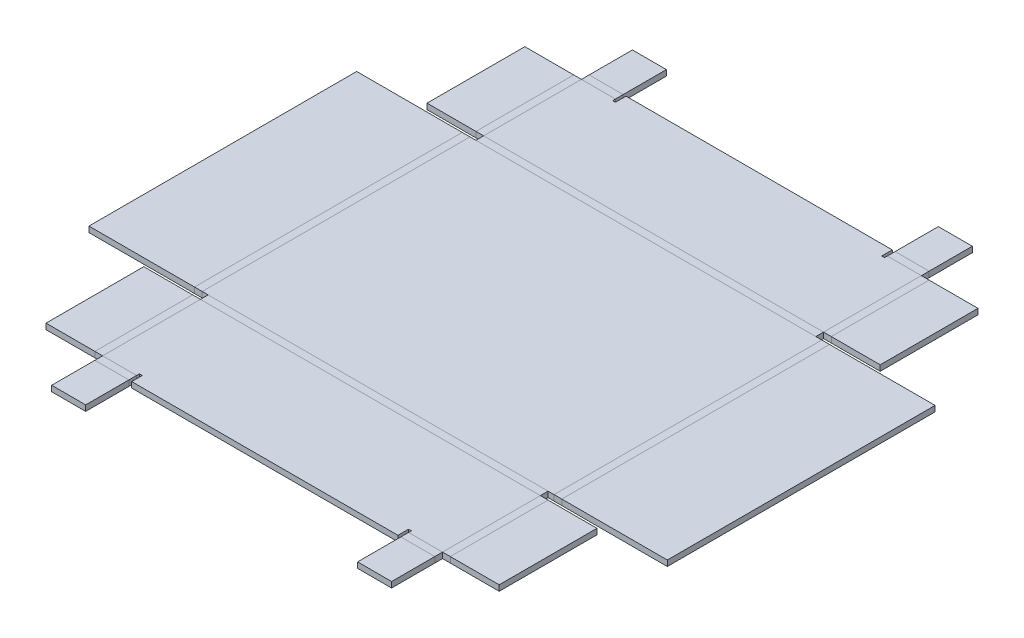
from build123d import *

# Parameters (mm, degrees)
SKETCH1_W                      = 120
SKETCH1_H                      = 100
BASE_FLANGE1_DEPTH             = 2
EDGE_FLANGE1_STRIP_W           = 9.4732
EDGE_FLANGE1_STRIP_H           = 2
EDGE_FLANGE1_STRIP_CUT_DEPTH   = 120
EDGE_FLANGE1_STRIP_2_W         = 9.4732
EDGE_FLANGE1_STRIP_2_H         = 2
EDGE_FLANGE1_STRIP_CUT_2_DEPTH = 120
EDGE_FLANGE1_DEPTH             = 120
EDGE_FLANGE1_BEND_DEPTH        = 120
EDGE_FLANGE2_DEPTH             = 94.5268
EDGE_FLANGE2_BEND_DEPTH        = 94.5268
EDGE_FLANGE5_STRIP_W           = 9.4732
EDGE_FLANGE5_STRIP_H           = 2
EDGE_FLANGE5_STRIP_CUT_DEPTH   = 12
EDGE_FLANGE5_RELIEF_W          = 10.4732
EDGE_FLANGE5_RELIEF_H          = 1
EDGE_FLANGE5_RELIEF_CUT_DEPTH  = 2
EDGE_FLANGE5_DEPTH             = 12
EDGE_FLANGE6_STRIP_W           = 9.4732
EDGE_FLANGE6_STRIP_H           = 2
EDGE_FLANGE6_STRIP_CUT_DEPTH   = 12
EDGE_FLANGE6_RELIEF_W          = 10.4732
EDGE_FLANGE6_RELIEF_H          = 1
EDGE_FLANGE6_RELIEF_CUT_DEPTH  = 2
EDGE_FLANGE6_DEPTH             = 12
EDGE_FLANGE7_STRIP_W           = 9.4732
EDGE_FLANGE7_STRIP_H           = 2
EDGE_FLANGE7_STRIP_CUT_DEPTH   = 12
EDGE_FLANGE7_RELIEF_W          = 10.4732
EDGE_FLANGE7_RELIEF_H          = 1
EDGE_FLANGE7_RELIEF_CUT_DEPTH  = 2
EDGE_FLANGE7_DEPTH             = 12
EDGE_FLANGE8_STRIP_W           = 9.4732
EDGE_FLANGE8_STRIP_H           = 2
EDGE_FLANGE8_STRIP_CUT_DEPTH   = 12
EDGE_FLANGE8_RELIEF_W          = 10.4732
EDGE_FLANGE8_RELIEF_H          = 1
EDGE_FLANGE8_RELIEF_CUT_DEPTH  = 2
EDGE_FLANGE8_DEPTH             = 12
EDGE_FLANGE9_DEPTH             = 34.5268
EDGE_FLANGE9_BEND_DEPTH        = 34.5268
EDGE_FLANGE9_BEND_2_DEPTH      = 34.5268
EDGE_FLANGE9_BEND_3_DEPTH      = 34.5268
UNFOLD1_START                  = 2
UNFOLD1_DEPTH                  = 38
UNFOLD1_2_DEPTH                = 2


# Read off the part's stored shape, not the designer's step: Unfold1
# Sheet-metal steps are written as plain solids
with BuildPart() as part:
    # Sketch1 → Base-Flange1 (new body)
    with BuildSketch(Plane(origin=(0, 0, 0), x_dir=(1, 0, 0), z_dir=(0, 1, 0))):
        Rectangle(SKETCH1_W, SKETCH1_H)
    extrude(amount=BASE_FLANGE1_DEPTH)

    # Edge-Flange1 strip (across the edge) → Edge-Flange1 strip cut (cut)
    with BuildSketch(Plane(origin=(60, 2, -50), x_dir=(0, 0, 1), z_dir=(-1, 0, 0))):
        with Locations((-2, -1)):
            Rectangle(EDGE_FLANGE1_STRIP_W, EDGE_FLANGE1_STRIP_H)
    extrude(amount=EDGE_FLANGE1_STRIP_CUT_DEPTH, mode=Mode.SUBTRACT)

    # Edge-Flange1 strip 2 (across the edge) → Edge-Flange1 strip cut 2 (cut)
    with BuildSketch(Plane(origin=(-60, 2, 50), x_dir=(0, 0, -1), z_dir=(1, 0, 0))):
        with Locations((-2, -1)):
            Rectangle(EDGE_FLANGE1_STRIP_2_W, EDGE_FLANGE1_STRIP_2_H)
    extrude(amount=EDGE_FLANGE1_STRIP_CUT_2_DEPTH, mode=Mode.SUBTRACT)

    # Edge-Flange1 section (across the edge) → Edge-Flange1 (add)
    with BuildSketch(Plane(origin=(60, 2, -50), x_dir=(0, 0, 1), z_dir=(-1, 0, 0))):
        with BuildLine():
            Line((0, 0.7366), (0, 38))
            Line((0, 38), (2, 38))
            Line((2, 38), (2, 0.7366))
            ThreePointArc((2, 0.7366), (2.215745145, 0.215745145), (2.7366, 0))
            Line((2.7366, 0), (2.7366, -2))
            ThreePointArc((2.7366, -2), (0.801531583, -1.198468417), (0, 0.7366))
        make_face()
    extrude(amount=EDGE_FLANGE1_DEPTH)

    # Edge-Flange1 section 2 (across the edge) → Edge-Flange1 bend (add)
    with BuildSketch(Plane(origin=(-60, 2, 50), x_dir=(0, 0, -1), z_dir=(1, 0, 0))):
        with BuildLine():
            Line((0, 0.7366), (0, 38))
            Line((0, 38), (2, 38))
            Line((2, 38), (2, 0.7366))
            ThreePointArc((2, 0.7366), (2.215745145, 0.215745145), (2.7366, 0))
            Line((2.7366, 0), (2.7366, -2))
            ThreePointArc((2.7366, -2), (0.801531583, -1.198468417), (0, 0.7366))
        make_face()
    extrude(amount=EDGE_FLANGE1_BEND_DEPTH)

    # Edge-Flange2 section (across the edge) → Edge-Flange2 (add)
    with BuildSketch(Plane(origin=(-62.8366, 2, -47.2634), x_dir=(1, 0, 0), z_dir=(0, 0, 1))):
        with BuildLine():
            Line((-2, 0.7366), (-2, 38))
            Line((-2, 38), (0, 38))
            Line((0, 38), (0, 0.7366))
            ThreePointArc((0, 0.7366), (0.215745145, 0.215745145), (0.7366, 0))
            Line((0.7366, 0), (2.8366, 0))
            Line((2.8366, 0), (2.8366, -2))
            Line((2.8366, -2), (0.7366, -2))
            ThreePointArc((0.7366, -2), (-1.198468417, -1.198468417), (-2, 0.7366))
        make_face()
    extrude(amount=EDGE_FLANGE2_DEPTH)

    # Edge-Flange2 section 2 (across the edge) → Edge-Flange2 bend (add)
    with BuildSketch(Plane(origin=(62.8366, 2, 47.2634), x_dir=(-1, 0, 0), z_dir=(0, 0, -1))):
        with BuildLine():
            Line((-2, 0.7366), (-2, 38))
            Line((-2, 38), (0, 38))
            Line((0, 38), (0, 0.7366))
            ThreePointArc((0, 0.7366), (0.215745145, 0.215745145), (0.7366, 0))
            Line((0.7366, 0), (2.8366, 0))
            Line((2.8366, 0), (2.8366, -2))
            Line((2.8366, -2), (0.7366, -2))
            ThreePointArc((0.7366, -2), (-1.198468417, -1.198468417), (-2, 0.7366))
        make_face()
    extrude(amount=EDGE_FLANGE2_BEND_DEPTH)

    # Edge-Flange5 strip (across the edge) → Edge-Flange5 strip cut (cut)
    with BuildSketch(Plane(origin=(48, 40, 48), x_dir=(0, -1, 0), z_dir=(1, 0, 0))):
        with Locations((-2, -1)):
            Rectangle(EDGE_FLANGE5_STRIP_W, EDGE_FLANGE5_STRIP_H)
    extrude(amount=EDGE_FLANGE5_STRIP_CUT_DEPTH, mode=Mode.SUBTRACT)

    # Edge-Flange5 relief (on the sheet) → Edge-Flange5 relief cut (cut)
    with BuildSketch(Plane(origin=(48, 37.2634, 48), x_dir=(0, -1, 0), z_dir=(0, 0, -1))):
        with Locations((-4.2366, 0.5)):
            Rectangle(EDGE_FLANGE5_RELIEF_W, EDGE_FLANGE5_RELIEF_H)
    extrude(amount=-EDGE_FLANGE5_RELIEF_CUT_DEPTH, mode=Mode.SUBTRACT)

    # Edge-Flange5 section (across the edge) → Edge-Flange5 (add)
    with BuildSketch(Plane(origin=(48, 40, 48), x_dir=(0, -1, 0), z_dir=(1, 0, 0))):
        with BuildLine():
            Line((0, 0.7366), (0, 16))
            Line((0, 16), (2, 16))
            Line((2, 16), (2, 0.7366))
            ThreePointArc((2, 0.7366), (2.215745145, 0.215745145), (2.7366, 0))
            Line((2.7366, 0), (2.7366, -2))
            ThreePointArc((2.7366, -2), (0.801531583, -1.198468417), (0, 0.7366))
        make_face()
    extrude(amount=EDGE_FLANGE5_DEPTH)

    # Edge-Flange6 strip (across the edge) → Edge-Flange6 strip cut (cut)
    with BuildSketch(Plane(origin=(-60, 40, 48), x_dir=(0, -1, 0), z_dir=(1, 0, 0))):
        with Locations((-2, -1)):
            Rectangle(EDGE_FLANGE6_STRIP_W, EDGE_FLANGE6_STRIP_H)
    extrude(amount=EDGE_FLANGE6_STRIP_CUT_DEPTH, mode=Mode.SUBTRACT)

    # Edge-Flange6 relief (on the sheet) → Edge-Flange6 relief cut (cut)
    with BuildSketch(Plane(origin=(-60, 37.2634, 48), x_dir=(0, -1, 0), z_dir=(0, 0, -1))):
        with Locations((-4.2366, -12.5)):
            Rectangle(EDGE_FLANGE6_RELIEF_W, EDGE_FLANGE6_RELIEF_H)
    extrude(amount=-EDGE_FLANGE6_RELIEF_CUT_DEPTH, mode=Mode.SUBTRACT)

    # Edge-Flange6 section (across the edge) → Edge-Flange6 (add)
    with BuildSketch(Plane(origin=(-60, 40, 48), x_dir=(0, -1, 0), z_dir=(1, 0, 0))):
        with BuildLine():
            Line((0, 0.7366), (0, 16))
            Line((0, 16), (2, 16))
            Line((2, 16), (2, 0.7366))
            ThreePointArc((2, 0.7366), (2.215745145, 0.215745145), (2.7366, 0))
            Line((2.7366, 0), (2.7366, -2))
            ThreePointArc((2.7366, -2), (0.801531583, -1.198468417), (0, 0.7366))
        make_face()
    extrude(amount=EDGE_FLANGE6_DEPTH)

    # Edge-Flange7 strip (across the edge) → Edge-Flange7 strip cut (cut)
    with BuildSketch(Plane(origin=(-48, 40, -48), x_dir=(0, -1, 0), z_dir=(-1, 0, 0))):
        with Locations((-2, -1)):
            Rectangle(EDGE_FLANGE7_STRIP_W, EDGE_FLANGE7_STRIP_H)
    extrude(amount=EDGE_FLANGE7_STRIP_CUT_DEPTH, mode=Mode.SUBTRACT)

    # Edge-Flange7 relief (on the sheet) → Edge-Flange7 relief cut (cut)
    with BuildSketch(Plane(origin=(-48, 37.2634, -48), x_dir=(0, -1, 0), z_dir=(0, 0, 1))):
        with Locations((-4.2366, 0.5)):
            Rectangle(EDGE_FLANGE7_RELIEF_W, EDGE_FLANGE7_RELIEF_H)
    extrude(amount=-EDGE_FLANGE7_RELIEF_CUT_DEPTH, mode=Mode.SUBTRACT)

    # Edge-Flange7 section (across the edge) → Edge-Flange7 (add)
    with BuildSketch(Plane(origin=(-48, 40, -48), x_dir=(0, -1, 0), z_dir=(-1, 0, 0))):
        with BuildLine():
            Line((0, 0.7366), (0, 16))
            Line((0, 16), (2, 16))
            Line((2, 16), (2, 0.7366))
            ThreePointArc((2, 0.7366), (2.215745145, 0.215745145), (2.7366, 0))
            Line((2.7366, 0), (2.7366, -2))
            ThreePointArc((2.7366, -2), (0.801531583, -1.198468417), (0, 0.7366))
        make_face()
    extrude(amount=EDGE_FLANGE7_DEPTH)

    # Edge-Flange8 strip (across the edge) → Edge-Flange8 strip cut (cut)
    with BuildSketch(Plane(origin=(60, 40, -48), x_dir=(0, -1, 0), z_dir=(-1, 0, 0))):
        with Locations((-2, -1)):
            Rectangle(EDGE_FLANGE8_STRIP_W, EDGE_FLANGE8_STRIP_H)
    extrude(amount=EDGE_FLANGE8_STRIP_CUT_DEPTH, mode=Mode.SUBTRACT)

    # Edge-Flange8 relief (on the sheet) → Edge-Flange8 relief cut (cut)
    with BuildSketch(Plane(origin=(60, 37.2634, -48), x_dir=(0, -1, 0), z_dir=(0, 0, 1))):
        with Locations((-4.2366, -12.5)):
            Rectangle(EDGE_FLANGE8_RELIEF_W, EDGE_FLANGE8_RELIEF_H)
    extrude(amount=-EDGE_FLANGE8_RELIEF_CUT_DEPTH, mode=Mode.SUBTRACT)

    # Edge-Flange8 section (across the edge) → Edge-Flange8 (add)
    with BuildSketch(Plane(origin=(60, 40, -48), x_dir=(0, -1, 0), z_dir=(-1, 0, 0))):
        with BuildLine():
            Line((0, 0.7366), (0, 16))
            Line((0, 16), (2, 16))
            Line((2, 16), (2, 0.7366))
            ThreePointArc((2, 0.7366), (2.215745145, 0.215745145), (2.7366, 0))
            Line((2.7366, 0), (2.7366, -2))
            ThreePointArc((2.7366, -2), (0.801531583, -1.198468417), (0, 0.7366))
        make_face()
    extrude(amount=EDGE_FLANGE8_DEPTH)

    # Edge-Flange9 section (across the edge) → Edge-Flange9 (add)
    with BuildSketch(Plane(origin=(60.7366, 37.2634, 48), x_dir=(-1, 0, 0), z_dir=(0, -1, 0))):
        with BuildLine():
            Line((-2, 0.7366), (-2, 18))
            Line((-2, 18), (0, 18))
            Line((0, 18), (0, 0.7366))
            ThreePointArc((0, 0.7366), (0.215745145, 0.215745145), (0.7366, 0))
            Line((0.7366, 0), (0.7366, -2))
            ThreePointArc((0.7366, -2), (-1.198468417, -1.198468417), (-2, 0.7366))
        make_face()
    extrude(amount=EDGE_FLANGE9_DEPTH)

    # Edge-Flange9 section 2 (across the edge) → Edge-Flange9 bend (add)
    with BuildSketch(Plane(origin=(60.7366, 2.7366, -48), x_dir=(-1, 0, 0), z_dir=(0, 1, 0))):
        with BuildLine():
            Line((-2, 0.7366), (-2, 18))
            Line((-2, 18), (0, 18))
            Line((0, 18), (0, 0.7366))
            ThreePointArc((0, 0.7366), (0.215745145, 0.215745145), (0.7366, 0))
            Line((0.7366, 0), (0.7366, -2))
            ThreePointArc((0.7366, -2), (-1.198468417, -1.198468417), (-2, 0.7366))
        make_face()
    extrude(amount=EDGE_FLANGE9_BEND_DEPTH)

    # Edge-Flange9 section 3 (across the edge) → Edge-Flange9 bend 2 (add)
    with BuildSketch(Plane(origin=(-60.7366, 37.2634, -48), x_dir=(1, 0, 0), z_dir=(0, -1, 0))):
        with BuildLine():
            Line((-2, 0.7366), (-2, 18))
            Line((-2, 18), (0, 18))
            Line((0, 18), (0, 0.7366))
            ThreePointArc((0, 0.7366), (0.215745145, 0.215745145), (0.7366, 0))
            Line((0.7366, 0), (0.7366, -2))
            ThreePointArc((0.7366, -2), (-1.198468417, -1.198468417), (-2, 0.7366))
        make_face()
    extrude(amount=EDGE_FLANGE9_BEND_2_DEPTH)

    # Edge-Flange9 section 4 (across the edge) → Edge-Flange9 bend 3 (add)
    with BuildSketch(Plane(origin=(-60.7366, 2.7366, 48), x_dir=(1, 0, 0), z_dir=(0, 1, 0))):
        with BuildLine():
            Line((-2, 0.7366), (-2, 18))
            Line((-2, 18), (0, 18))
            Line((0, 18), (0, 0.7366))
            ThreePointArc((0, 0.7366), (0.215745145, 0.215745145), (0.7366, 0))
            Line((0.7366, 0), (0.7366, -2))
            ThreePointArc((0.7366, -2), (-1.198468417, -1.198468417), (-2, 0.7366))
        make_face()
    extrude(amount=EDGE_FLANGE9_BEND_3_DEPTH)

    # Unfold1 outline → Unfold1 (cut)
    with BuildSketch(Plane(origin=(0, 0, 0), x_dir=(1, 0, 0), z_dir=(0, 1, 0)).offset(UNFOLD1_START)):
        with BuildLine():
            Line((62.7366, -47.2634), (64.8366, -47.2634))
            Line((64.8366, -47.2634), (64.8366, 47.2634))
            Line((64.8366, 47.2634), (62.7366, 47.2634))
            ThreePointArc((62.7366, 47.2634), (61.935068417, 49.198468417), (60, 50))
            Line((60, 50), (-60, 50))
            ThreePointArc((-60, 50), (-61.935068417, 49.198468417), (-62.7366, 47.2634))
            Line((-62.7366, 47.2634), (-64.8366, 47.2634))
            Line((-64.8366, 47.2634), (-64.8366, -47.2634))
            Line((-64.8366, -47.2634), (-62.7366, -47.2634))
            ThreePointArc((-62.7366, -47.2634), (-61.935068417, -49.198468417), (-60, -50))
            Line((-60, -50), (60, -50))
            ThreePointArc((60, -50), (61.935068417, -49.198468417), (62.7366, -47.2634))
        make_face()
        with BuildLine():
            ThreePointArc((60.7366, -47.2634), (60.520854855, -47.784254855), (60, -48))
            Line((60, -48), (60, -47.2634))
            Line((60, -47.2634), (60.7366, -47.2634))
        make_face(mode=Mode.SUBTRACT)
        with BuildLine():
            Line((-60.7366, -47.2634), (-60, -47.2634))
            Line((-60, -47.2634), (-60, -48))
            ThreePointArc((-60, -48), (-60.520854855, -47.784254855), (-60.7366, -47.2634))
        make_face(mode=Mode.SUBTRACT)
        with BuildLine():
            Line((-60, 47.2634), (-60.7366, 47.2634))
            ThreePointArc((-60.7366, 47.2634), (-60.520854855, 47.784254855), (-60, 48))
            Line((-60, 48), (-60, 47.2634))
        make_face(mode=Mode.SUBTRACT)
        with BuildLine():
            Line((60.7366, 47.2634), (60, 47.2634))
            Line((60, 47.2634), (60, 48))
            ThreePointArc((60, 48), (60.520854855, 47.784254855), (60.7366, 47.2634))
        make_face(mode=Mode.SUBTRACT)
    extrude(amount=UNFOLD1_DEPTH, mode=Mode.SUBTRACT)

    # Unfold1 2 outline → Unfold1 2 (add)
    with BuildSketch(Plane(origin=(0, 0, 0), x_dir=(1, 0, 0), z_dir=(0, 1, 0))):
        Polygon((102.091244901, -47.2634), (102.091244901, 47.2634), (60, 47.2634), (60, 49.991244901), (79.991244901, 49.991244901), (79.991244901, 84.518044901), (60, 84.518044901), (60, 102.509289802), (48, 102.509289802), (48, 83.518044901), (47, 83.518044901), (47, 87.254644901), (-47, 87.254644901), (-47, 83.518044901), (-48, 83.518044901), (-48, 102.509289802), (-60, 102.509289802), (-60, 84.518044901), (-79.991244901, 84.518044901), (-79.991244901, 49.991244901), (-60, 49.991244901), (-60, 47.2634), (-102.091244901, 47.2634), (-102.091244901, -47.2634), (-60, -47.2634), (-60, -49.991244901), (-79.991244901, -49.991244901), (-79.991244901, -84.518044901), (-60, -84.518044901), (-60, -102.509289802), (-48, -102.509289802), (-48, -83.518044901), (-47, -83.518044901), (-47, -87.254644901), (47, -87.254644901), (47, -83.518044901), (48, -83.518044901), (48, -102.509289802), (60, -102.509289802), (60, -84.518044901), (79.991244901, -84.518044901), (79.991244901, -49.991244901), (60, -49.991244901), (60, -47.2634), align=None)
    extrude(amount=UNFOLD1_2_DEPTH)


solid = part.part
